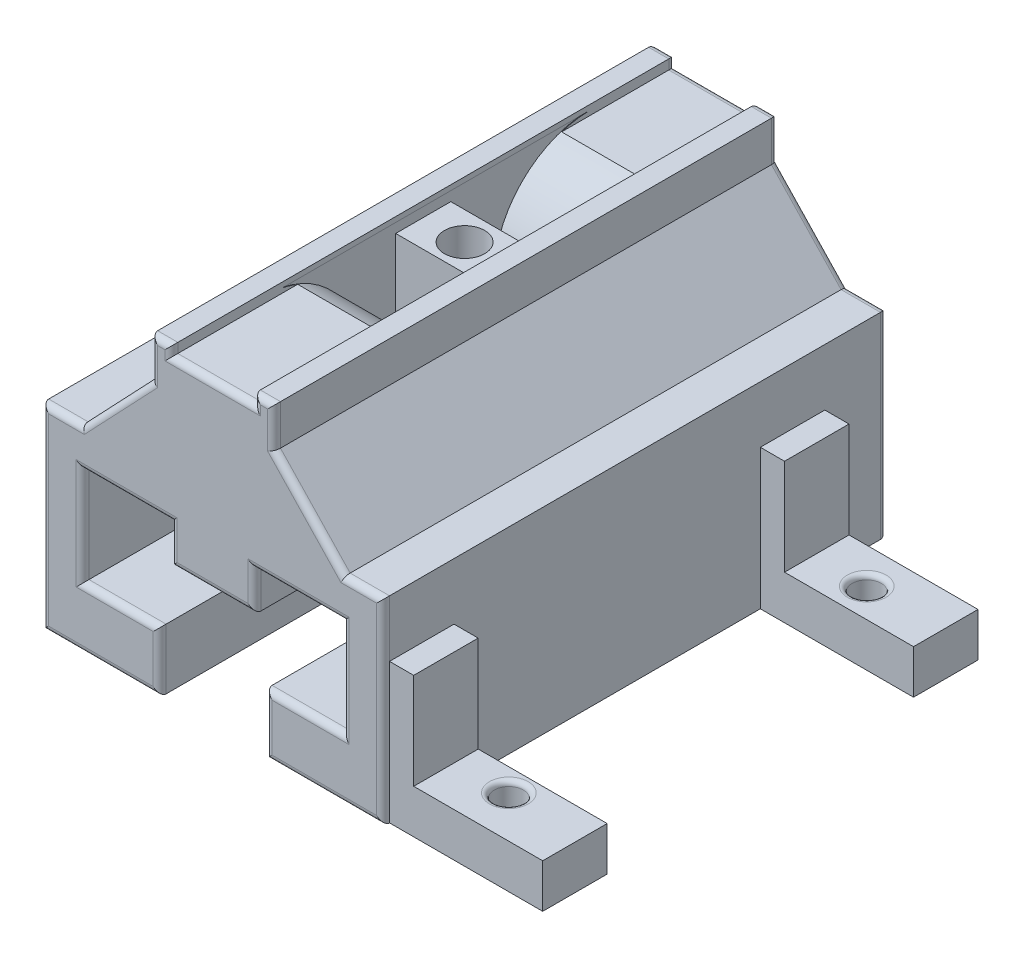
from build123d import *

# Parameters (mm, degrees)
BOSS_EXTRUDE1_DEPTH = 39.6875
SKETCH3_R           = 1.5875
CUT_EXTRUDE1_DEPTH  = 39.6875
CUT_EXTRUDE3_DEPTH  = 5
CUT_EXTRUDE5_DEPTH  = 6.5
FILLET1_R           = 0.508
SKETCH7_W           = 5.08
SKETCH7_H           = 11.02028101
BOSS_EXTRUDE2_DEPTH = 1.905
SKETCH8_W           = 5.08
SKETCH8_H           = 3.45092897
BOSS_EXTRUDE3_DEPTH = 10.16
CUT_EXTRUDE7_REACH  = 55.127
SKETCH9_R           = 1.143
FILLET2_R           = 0.381


with BuildPart() as part:
    # Sketch2 → Boss-Extrude1 (new body)
    with BuildSketch(Plane.XY):
        Polygon((-4.175, 2.64761179), (-10.25, 2.64761179), (-10.25, 10.33111179), (-3.3, 10.33111179), (-3.3, 7.28311179), (3.3, 7.28311179), (3.3, 10.33111179), (10.25, 10.33111179), (10.25, 2.64761179), (4.175, 2.64761179), (4.175, -2.11488821), (13.425, -2.11488821), (13.425, 13.37911179), (10.325, 13.37911179), (4.8375, 19.15761179), (4.8375, 22.33261179), (3.25, 22.33261179), (3.25, 21.57061179), (-3.25, 21.57061179), (-3.25, 22.33261179), (-4.8375, 22.33261179), (-4.8375, 19.15761179), (-10.325, 13.37911179), (-13.425, 13.37911179), (-13.425, -2.11488821), (-4.175, -2.11488821), align=None)
    extrude(amount=BOSS_EXTRUDE1_DEPTH)

    # Sketch3 → Cut-Extrude1 (cut)
    with BuildSketch(Plane(origin=(0, 21.57061179, 0), x_dir=(1, 0, 0), z_dir=(0, 1, 0))):
        with Locations((0, -19.84375)):
            Circle(SKETCH3_R)
    extrude(amount=-CUT_EXTRUDE1_DEPTH, mode=Mode.SUBTRACT)

    # Sketch4 → Cut-Extrude3 (cut)
    with BuildSketch(Plane.XZ.offset(-7.28311179)):
        Polygon((-1.593486743, 17.08375), (1.593486743, 17.08375), (3.186973486, 19.84375), (1.593486743, 22.60375), (-1.593486743, 22.60375), (-3.186973486, 19.84375), align=None)
    extrude(amount=-CUT_EXTRUDE3_DEPTH, mode=Mode.SUBTRACT)

    # Sketch5 → Cut-Extrude5 (cut)
    with BuildSketch(Plane.ZY.offset(3.3)):
        with BuildLine():
            Line((30.935486639, 21.929608435), (6.793752093, 21.929608435))
            ThreePointArc((6.793752093, 21.929608435), (14.106882481, 15.699384594), (9.473965766, 7.28311179))
            Line((9.473965766, 7.28311179), (17.626036587, 7.28311179))
            Line((17.626036587, 7.28311179), (17.626036587, 21.128362833))
            Line((17.626036587, 21.128362833), (21.966828552, 21.128362833))
            Line((21.966828552, 21.128362833), (21.966828552, 7.28311179))
            Line((21.966828552, 7.28311179), (30.118899373, 7.28311179))
            ThreePointArc((30.118899373, 7.28311179), (24.926702023, 14.918604722), (30.935486639, 21.929608435))
        make_face()
    extrude(amount=-CUT_EXTRUDE5_DEPTH, mode=Mode.SUBTRACT)

    # Fillet1
    fillet1_edges = [part.edges().sort_by_distance(p)[0] for p in [
        (-7.2125, 2.64761179, 0),
        (-10.25, 6.48936179, 0),
        (6.775, 10.33111179, 0),
        (-3.3, 8.80711179, 0),
        (0, 7.28311179, 0),
        (3.3, 8.80711179, 0),
        (10.25, 6.48936179, 0),
        (7.2125, 2.64761179, 0),
        (4.175, 0.26636179, 0),
        (8.8, -2.11488821, 0),
        (13.425, 5.63211179, 0),
        (11.875, 13.37911179, 0),
        (7.58125, 16.26836179, 0),
        (4.8375, 20.74511179, 0),
        (4.04375, 22.33261179, 0),
        (3.25, 21.95161179, 0),
        (0, 21.57061179, 0),
        (-3.25, 21.95161179, 0),
        (-4.04375, 22.33261179, 0),
        (-4.8375, 20.74511179, 0),
        (-7.58125, 16.26836179, 0),
        (-11.875, 13.37911179, 0),
        (-13.425, 5.63211179, 0),
        (-8.8, -2.11488821, 0),
        (-4.175, 0.26636179, 0),
        (-8.8, -2.11488821, 39.6875),
        (-13.425, 5.63211179, 39.6875),
        (-11.875, 13.37911179, 39.6875),
        (-7.58125, 16.26836179, 39.6875),
        (-4.8375, 20.74511179, 39.6875),
        (-4.04375, 22.33261179, 39.6875),
        (-3.25, 21.95161179, 39.6875),
        (0, 21.57061179, 39.6875),
        (3.25, 21.95161179, 39.6875),
        (4.04375, 22.33261179, 39.6875),
        (4.8375, 20.74511179, 39.6875),
        (7.58125, 16.26836179, 39.6875),
        (11.875, 13.37911179, 39.6875),
        (13.425, 5.63211179, 39.6875),
        (8.8, -2.11488821, 39.6875),
        (4.175, 0.26636179, 39.6875),
        (7.2125, 2.64761179, 39.6875),
        (10.25, 6.48936179, 39.6875),
        (6.775, 10.33111179, 39.6875),
        (3.3, 8.80711179, 39.6875),
        (0, 7.28311179, 39.6875),
        (-3.3, 8.80711179, 39.6875),
        (-10.25, 6.48936179, 39.6875),
        (-7.2125, 2.64761179, 39.6875),
        (-4.175, 0.26636179, 39.6875),
        (-6.775, 10.33111179, 0),
        (-6.775, 10.33111179, 39.6875),
    ]]
    fillet(fillet1_edges, radius=FILLET1_R)

    # Sketch7 → Boss-Extrude2 (add)
    with BuildSketch(Plane(origin=(13.425, 0, 0), x_dir=(0, 0, -1), z_dir=(1, 0, 0))):
        with Locations((-36.6395, 3.395252295)):
            Rectangle(SKETCH7_W, SKETCH7_H)
        with Locations((-7.4295, 3.395252295)):
            Rectangle(SKETCH7_W, SKETCH7_H)
    extrude(amount=BOSS_EXTRUDE2_DEPTH)

    # Sketch8 → Boss-Extrude3 (add)
    with BuildSketch(Plane(origin=(15.33, 0, 0), x_dir=(0, 0, -1), z_dir=(1, 0, 0))):
        with Locations((-36.6395, -0.389423725)):
            Rectangle(SKETCH8_W, SKETCH8_H)
        with Locations((-7.4295, -0.389423725)):
            Rectangle(SKETCH8_W, SKETCH8_H)
    extrude(amount=BOSS_EXTRUDE3_DEPTH)

    # Sketch9 → Cut-Extrude7 (cut, up to next)
    with BuildSketch(Plane.XZ.offset(2.11488821), mode=Mode.PRIVATE) as cut_extrude7_sk1:
        with Locations((19.521, 7.6835)):
            Circle(SKETCH9_R)
    cut_extrude7_tool1 = extrude(cut_extrude7_sk1.sketch, amount=-CUT_EXTRUDE7_REACH, mode=Mode.PRIVATE) & part.part
    # Sketch9 → Cut-Extrude7 (cut, up to next)
    with BuildSketch(Plane.XZ.offset(2.11488821), mode=Mode.PRIVATE) as cut_extrude7_sk2:
        with Locations((19.521, 35.8775)):
            Circle(SKETCH9_R)
    cut_extrude7_tool2 = extrude(cut_extrude7_sk2.sketch, amount=-CUT_EXTRUDE7_REACH, mode=Mode.PRIVATE) & part.part
    add(cut_extrude7_tool1.solids().sort_by_distance((19.521, -2.114888, 7.6835))[0], mode=Mode.SUBTRACT)
    add(cut_extrude7_tool2.solids().sort_by_distance((19.521, -2.114888, 35.8775))[0], mode=Mode.SUBTRACT)

    # Fillet2
    fillet2_edges = [part.edges().sort_by_distance(p)[0] for p in [
        (18.378, -2.11488821, 7.6835),
        (18.378, -2.11488821, 35.8775),
        (18.378, 1.33604076, 7.6835),
        (18.378, 1.33604076, 35.8775),
    ]]
    fillet(fillet2_edges, radius=FILLET2_R)


solid = part.part
